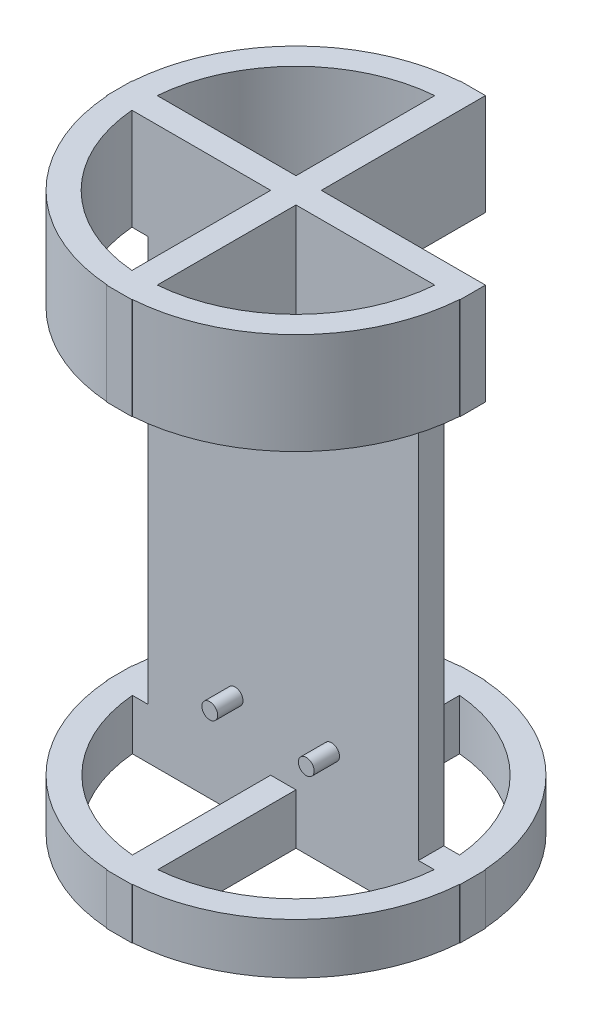
from build123d import *

# Parameters (mm, degrees)
SKETCH1_R           = 34.9
SKETCH1_R_2         = 29.9
EXTRUDE_THIN1_DEPTH = 10
SKETCH1_3_W         = 5
SKETCH1_3_H         = 69.8
SKETCH1_3_W_2       = 69.8
SKETCH1_3_H_2       = 5
EXTRUDE_THIN2_DEPTH = 10
SKETCH2_W           = 53.342781532
SKETCH2_H           = 5
BOSS_EXTRUDE1_DEPTH = 80
SKETCH3_R           = 1.5621
BOSS_EXTRUDE2_DEPTH = 5
BOSS_EXTRUDE4_DEPTH = 20
SKETCH6_6_W         = 5
SKETCH6_6_H         = 69.8
SKETCH6_6_W_2       = 69.8
SKETCH6_6_H_2       = 5
EXTRUDE_THIN4_DEPTH = 20


with BuildPart() as part:
    # Sketch1 → Extrude-Thin1 (new body)
    with BuildSketch(Plane(origin=(0, 0, 0), x_dir=(1, 0, 0), z_dir=(0, 1, 0))):
        Circle(SKETCH1_R)
        Circle(SKETCH1_R_2, mode=Mode.SUBTRACT)
    extrude(amount=EXTRUDE_THIN1_DEPTH)

    # Sketch1<3> → Extrude-Thin2 (add)
    with BuildSketch(Plane(origin=(0, 0, 0), x_dir=(1, 0, 0), z_dir=(0, 1, 0))):
        Rectangle(SKETCH1_3_W, SKETCH1_3_H)
        Rectangle(SKETCH1_3_W_2, SKETCH1_3_H_2)
    extrude(amount=EXTRUDE_THIN2_DEPTH)

    # Sketch2 → Boss-Extrude1 (add)
    with BuildSketch(Plane(origin=(0, 10, 0), x_dir=(1, 0, 0), z_dir=(0, 1, 0))):
        Rectangle(SKETCH2_W, SKETCH2_H)
    extrude(amount=BOSS_EXTRUDE1_DEPTH)

    # Sketch3 → Boss-Extrude2 (add)
    with BuildSketch(Plane.XY.offset(2.5)):
        with Locations((-9.525, 77.1246)):
            Circle(SKETCH3_R)
        with Locations((-9.525, 20)):
            Circle(SKETCH3_R)
        with Locations((9.525, 20)):
            Circle(SKETCH3_R)
        with Locations((9.525, 77.1246)):
            Circle(SKETCH3_R)
    extrude(amount=BOSS_EXTRUDE2_DEPTH)



with BuildPart() as body_2:
    # Sketch6 → Boss-Extrude4 (new body)
    with BuildSketch(Plane(origin=(0, 90, 0), x_dir=(1, 0, 0), z_dir=(0, 1, 0))):
        with BuildLine():
            Line((0, 30), (0, 34.9))
            ThreePointArc((0, 34.9), (-24.678026663, -24.678026663), (34.9, 0))
            Line((34.9, 0), (30, 0))
            ThreePointArc((30, 0), (-21.213203436, -21.213203436), (0, 30))
        make_face()
    extrude(amount=BOSS_EXTRUDE4_DEPTH)


with BuildPart() as part_1:
    add(part.part)

    add(body_2.part)  # Extrude-Thin4 merges body 2
    # Sketch6<6> → Extrude-Thin4 (add)
    with BuildSketch(Plane(origin=(0, 90, 0), x_dir=(1, 0, 0), z_dir=(0, 1, 0))):
        Rectangle(SKETCH6_6_W, SKETCH6_6_H)
        Rectangle(SKETCH6_6_W_2, SKETCH6_6_H_2)
    extrude(amount=EXTRUDE_THIN4_DEPTH)


solid = part_1.part
